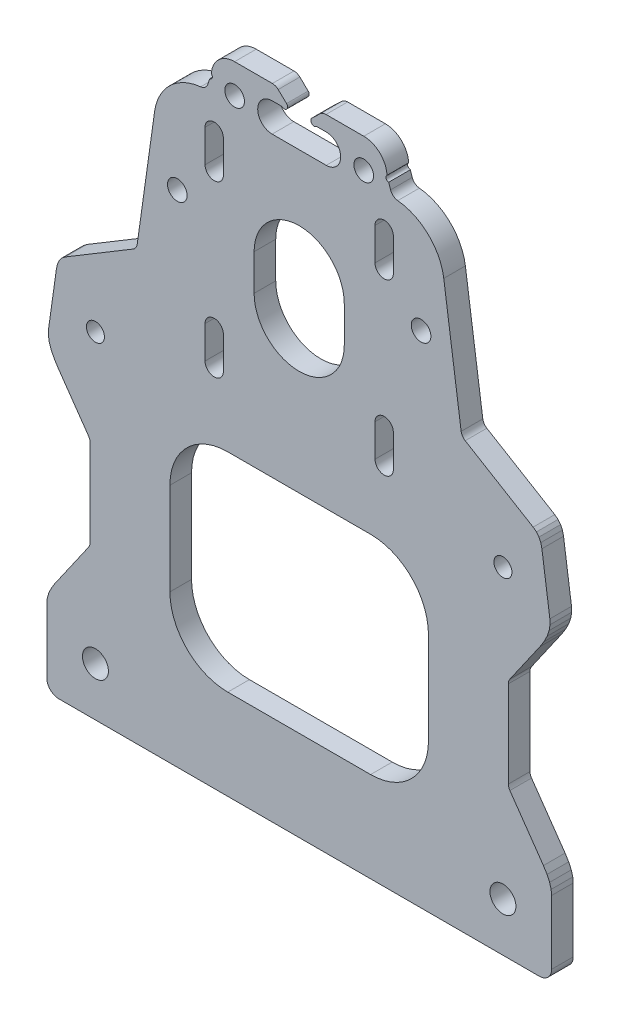
from build123d import *

# Parameters (mm, degrees)
MODEL_R             = 3.6
MODEL_R_2           = 2.725
MODEL_R_3           = 2.5
BOSS_EXTRUDE1_DEPTH = 6


with BuildPart() as part:
    # Model → Boss-Extrude1 (new body)
    with BuildSketch(Plane.XY):
        with BuildLine():
            Line((-66.64035, 0), (66.64035, 0))
            ThreePointArc((66.64035, 0), (69.016228785, 0.984121215), (70.00035, 3.36))
            Line((70.00035, 3.36), (70.00035, 21.1105))
            Line((70.00035, 21.1105), (69.86629813, 22.498114684))
            Line((69.86629813, 22.498114684), (69.446311232, 23.988387428))
            Line((69.446311232, 23.988387428), (68.733529412, 25.548929055))
            Line((68.733529412, 25.548929055), (67.734761359, 27.16155254))
            Line((67.734761359, 27.16155254), (58.431673409, 40.525169242))
            ThreePointArc((58.431673409, 40.525169242), (58.118153534, 41.164216889), (58.01035, 41.867818343))
            Line((58.01035, 41.867818343), (58.01035, 65.939651469))
            ThreePointArc((58.01035, 65.939651469), (58.11831888, 66.643779624), (58.432304432, 67.283206562))
            Line((58.432304432, 67.283206562), (66.78383855, 79.267931576))
            Line((66.78383855, 79.267931576), (67.914068691, 81.051661321))
            Line((67.914068691, 81.051661321), (68.763177176, 82.764680123))
            Line((68.763177176, 82.764680123), (69.316681884, 84.394671222))
            Line((69.316681884, 84.394671222), (69.565395366, 85.915970428))
            Line((69.565395366, 85.915970428), (69.519060346, 87.308284697))
            Line((69.519060346, 87.308284697), (67.30949192, 103.030180971))
            Line((67.30949192, 103.030180971), (66.999561947, 104.350057085))
            Line((66.999561947, 104.350057085), (66.487504991, 105.437863083))
            Line((66.487504991, 105.437863083), (65.782163484, 106.319853558))
            Line((65.782163484, 106.319853558), (64.875433482, 107.017560512))
            Line((64.875433482, 107.017560512), (46.0351373, 118.337952538))
            ThreePointArc((46.0351373, 118.337952538), (45.285845094, 119.055243779), (44.918346815, 120.025238907))
            Line((44.918346815, 120.025238907), (40.094015429, 154.352140382))
            ThreePointArc((40.094015429, 154.352140382), (35.836168672, 162.70125074), (27.337884769, 166.652968529))
            ThreePointArc((27.337884769, 166.652968529), (26.108825382, 167.158066229), (25.350203438, 168.24903067))
            Line((25.350203438, 168.24903067), (24.828755998, 169.817409171))
            ThreePointArc((24.828755998, 169.817409171), (24.117671094, 170.371357056), (24.355513409, 171.2408))
            ThreePointArc((24.355513409, 171.2408), (22.368316822, 175.612570409), (17.911140334, 177.4))
            Line((17.911140334, 177.4), (7.437786988, 177.4))
            ThreePointArc((7.437786988, 177.4), (6.567071518, 177.232740152), (5.820301357, 176.754769847))
            Line((5.820301357, 176.754769847), (3.50035, 174.5536))
            ThreePointArc((3.50035, 174.5536), (3.500375, 173.207275), (4.8467, 173.2073))
            Line((4.8467, 173.2073), (7.50035, 173.2073))
            ThreePointArc((7.50035, 173.2073), (11.50035, 169.2073), (7.50035, 165.2073))
            Line((7.50035, 165.2073), (-7.49965, 165.2073))
            ThreePointArc((-7.49965, 165.2073), (-11.49965, 169.2073), (-7.49965, 173.2073))
            Line((-7.49965, 173.2073), (-4.846, 173.2073))
            ThreePointArc((-4.846, 173.2073), (-3.499675, 173.207275), (-3.49965, 174.5536))
            Line((-3.49965, 174.5536), (-5.819601357, 176.754769848))
            ThreePointArc((-5.819601357, 176.754769848), (-6.566371518, 177.232740152), (-7.437086988, 177.4))
            Line((-7.437086988, 177.4), (-17.910440334, 177.4))
            ThreePointArc((-17.910440334, 177.4), (-22.367616822, 175.612570409), (-24.354813409, 171.2408))
            ThreePointArc((-24.354813409, 171.2408), (-24.116971094, 170.371357056), (-24.828055998, 169.817409171))
            Line((-24.828055998, 169.817409171), (-25.349503438, 168.24903067))
            ThreePointArc((-25.349503438, 168.24903067), (-26.108125382, 167.158066229), (-27.337184769, 166.652968529))
            ThreePointArc((-27.337184769, 166.652968529), (-35.835468672, 162.70125074), (-40.093315429, 154.352140382))
            Line((-40.093315429, 154.352140382), (-44.917646815, 120.025238907))
            ThreePointArc((-44.917646815, 120.025238907), (-45.285145095, 119.055243779), (-46.0344373, 118.337952538))
            Line((-46.0344373, 118.337952538), (-64.874733482, 107.017560512))
            Line((-64.874733482, 107.017560512), (-65.764454542, 106.336263813))
            Line((-65.764454542, 106.336263813), (-66.464064741, 105.473352073))
            Line((-66.464064741, 105.473352073), (-66.989930499, 104.37360872))
            Line((-66.989930499, 104.37360872), (-67.307930284, 103.030180971))
            Line((-67.307930284, 103.030180971), (-69.517498709, 87.308284697))
            Line((-69.517498709, 87.308284697), (-69.564336548, 85.915534746))
            Line((-69.564336548, 85.915534746), (-69.316250952, 84.392453689))
            Line((-69.316250952, 84.392453689), (-68.763104771, 82.761395172))
            Line((-68.763104771, 82.761395172), (-67.914669475, 81.049208688))
            Line((-67.914669475, 81.049208688), (-66.785659136, 79.267931576))
            Line((-66.785659136, 79.267931576), (-58.427548106, 67.280305558))
            ThreePointArc((-58.427548106, 67.280305558), (-58.113308938, 66.640672262), (-58.00525, 65.936257417))
            Line((-58.00525, 65.936257417), (-58.00525, 41.865084223))
            ThreePointArc((-58.00525, 41.865084223), (-58.113143434, 41.161196344), (-58.426916507, 40.521942406))
            Line((-58.426916507, 40.521942406), (-67.732826699, 27.16155254))
            Line((-67.732826699, 27.16155254), (-68.732119035, 25.548966105))
            Line((-68.732119035, 25.548966105), (-69.445294681, 23.988426858))
            Line((-69.445294681, 23.988426858), (-69.86552208, 22.498130488))
            Line((-69.86552208, 22.498130488), (-69.99965, 21.1105))
            Line((-69.99965, 21.1105), (-69.99965, 3.3593))
            ThreePointArc((-69.99965, 3.3593), (-69.01573381, 0.98391619), (-66.64035, 0))
        make_face()
        with Locations((-56.49965, 13.52)):
            Circle(MODEL_R, mode=Mode.SUBTRACT)
        with Locations((-17.89965, 169.2073)):
            Circle(MODEL_R_2, mode=Mode.SUBTRACT)
        with Locations((-33.79965, 138.65)):
            Circle(MODEL_R_2, mode=Mode.SUBTRACT)
        with Locations((-56.49965, 93.22)):
            Circle(MODEL_R_3, mode=Mode.SUBTRACT)
        with Locations((56.50035, 13.52)):
            Circle(MODEL_R, mode=Mode.SUBTRACT)
        with Locations((17.90035, 169.2073)):
            Circle(MODEL_R_2, mode=Mode.SUBTRACT)
        with Locations((33.80035, 138.65)):
            Circle(MODEL_R_2, mode=Mode.SUBTRACT)
        with Locations((56.50035, 93.22)):
            Circle(MODEL_R_3, mode=Mode.SUBTRACT)
        with BuildLine():
            Line((-19.80285, 25.0481), (19.80355, 25.0481))
            ThreePointArc((19.80355, 25.0481), (31.150351096, 29.748098904), (35.85035, 41.0949))
            Line((35.85035, 41.0949), (35.85035, 66.7013))
            ThreePointArc((35.85035, 66.7013), (31.150351096, 78.048101096), (19.80355, 82.7481))
            Line((19.80355, 82.7481), (-19.80285, 82.7481))
            ThreePointArc((-19.80285, 82.7481), (-31.149651096, 78.048101096), (-35.84965, 66.7013))
            Line((-35.84965, 66.7013), (-35.84965, 41.0949))
            ThreePointArc((-35.84965, 41.0949), (-31.149651096, 29.748098904), (-19.80285, 25.0481))
        make_face(mode=Mode.SUBTRACT)
        with BuildLine():
            Line((-26.10965, 157.54), (-26.10965, 148.54))
            ThreePointArc((-26.10965, 148.54), (-23.56965, 146), (-21.02965, 148.54))
            Line((-21.02965, 148.54), (-21.02965, 157.54))
            ThreePointArc((-21.02965, 157.54), (-23.56965, 160.08), (-26.10965, 157.54))
        make_face(mode=Mode.SUBTRACT)
        with BuildLine():
            Line((-26.10965, 110.4), (-26.10965, 101.4))
            ThreePointArc((-26.10965, 101.4), (-23.56965, 98.86), (-21.02965, 101.4))
            Line((-21.02965, 101.4), (-21.02965, 110.4))
            ThreePointArc((-21.02965, 110.4), (-23.56965, 112.94), (-26.10965, 110.4))
        make_face(mode=Mode.SUBTRACT)
        with BuildLine():
            Line((-12.49965, 134.47), (-12.49965, 124.47))
            ThreePointArc((-12.49965, 124.47), (0.00035, 111.97), (12.50035, 124.47))
            Line((12.50035, 124.47), (12.50035, 134.47))
            ThreePointArc((12.50035, 134.47), (0.00035, 146.97), (-12.49965, 134.47))
        make_face(mode=Mode.SUBTRACT)
        with BuildLine():
            Line((21.03035, 157.54), (21.03035, 148.54))
            ThreePointArc((21.03035, 148.54), (23.57035, 146), (26.11035, 148.54))
            Line((26.11035, 148.54), (26.11035, 157.54))
            ThreePointArc((26.11035, 157.54), (23.57035, 160.08), (21.03035, 157.54))
        make_face(mode=Mode.SUBTRACT)
        with BuildLine():
            Line((21.03035, 110.4), (21.03035, 101.4))
            ThreePointArc((21.03035, 101.4), (23.57035, 98.86), (26.11035, 101.4))
            Line((26.11035, 101.4), (26.11035, 110.4))
            ThreePointArc((26.11035, 110.4), (23.57035, 112.94), (21.03035, 110.4))
        make_face(mode=Mode.SUBTRACT)
    extrude(amount=BOSS_EXTRUDE1_DEPTH)


solid = part.part
